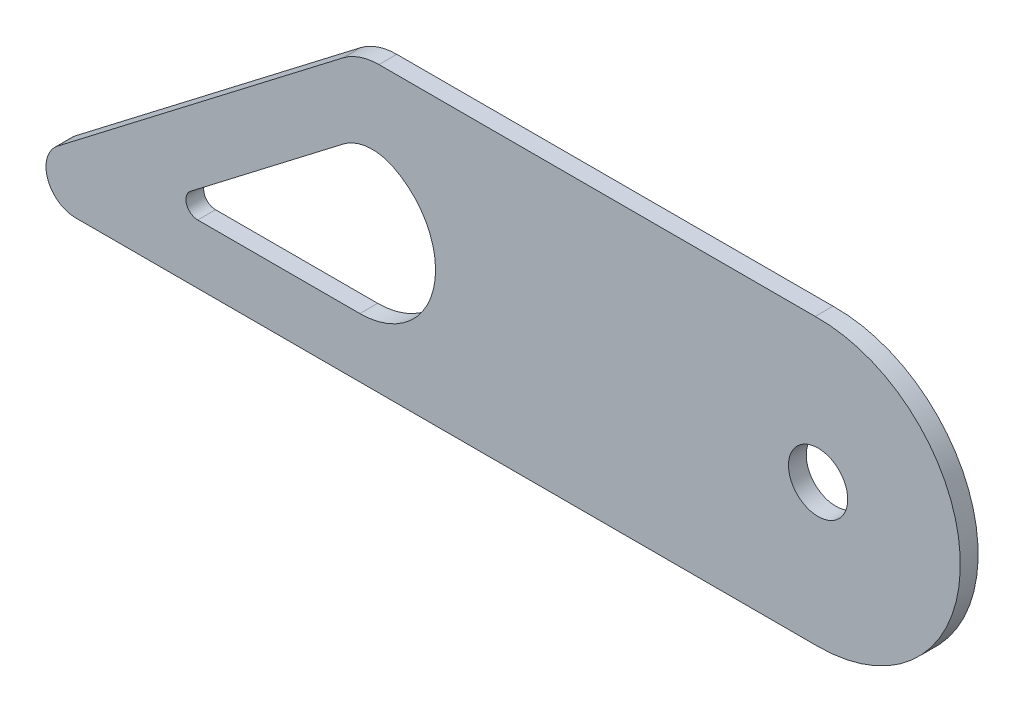
from build123d import *

# Parameters (mm, degrees)
SKETCH2_R           = 25
BOSS_EXTRUDE1_DEPTH = 7.5


with BuildPart() as part:
    # Sketch2 → Boss-Extrude1 (new, symmetric)
    with BuildSketch(Plane.XY):
        with BuildLine():
            Line((-398.468541926, -10.340558916), (-639.176480494, -195.145613098))
            ThreePointArc((-639.176480494, -195.145613098), (-647.624253491, -223.014518501), (-623.952086147, -239.97533364))
            Line((-623.952086147, -239.97533364), (2.432964843, -239.97533364))
            ThreePointArc((2.432964843, -239.97533364), (122.426798095, -118.758788701), (0, 0))
            Line((0, 0), (-368.019753232, 0))
            ThreePointArc((-368.019753232, 0), (-384.098122954, -2.655665311), (-398.468541926, -10.340558916))
        make_face()
        with Locations((2.432964843, -119.97533364)):
            Circle(SKETCH2_R, mode=Mode.SUBTRACT)
        with BuildLine():
            Line((-526.980915272, -172.043445423), (-398.014187587, -73.02841817))
            ThreePointArc((-398.014187587, -73.02841817), (-377.665337115, -64.957498045), (-356.115398822, -68.806605313))
            ThreePointArc((-356.115398822, -68.806605313), (-321.919160325, -140.519421114), (-384.098122954, -189.97533364))
            Line((-384.098122954, -189.97533364), (-520.891157533, -189.97533364))
            ThreePointArc((-520.891157533, -189.97533364), (-530.360024471, -183.191007584), (-526.980915272, -172.043445423))
        make_face(mode=Mode.SUBTRACT)
    extrude(amount=BOSS_EXTRUDE1_DEPTH, both=True)


solid = part.part
